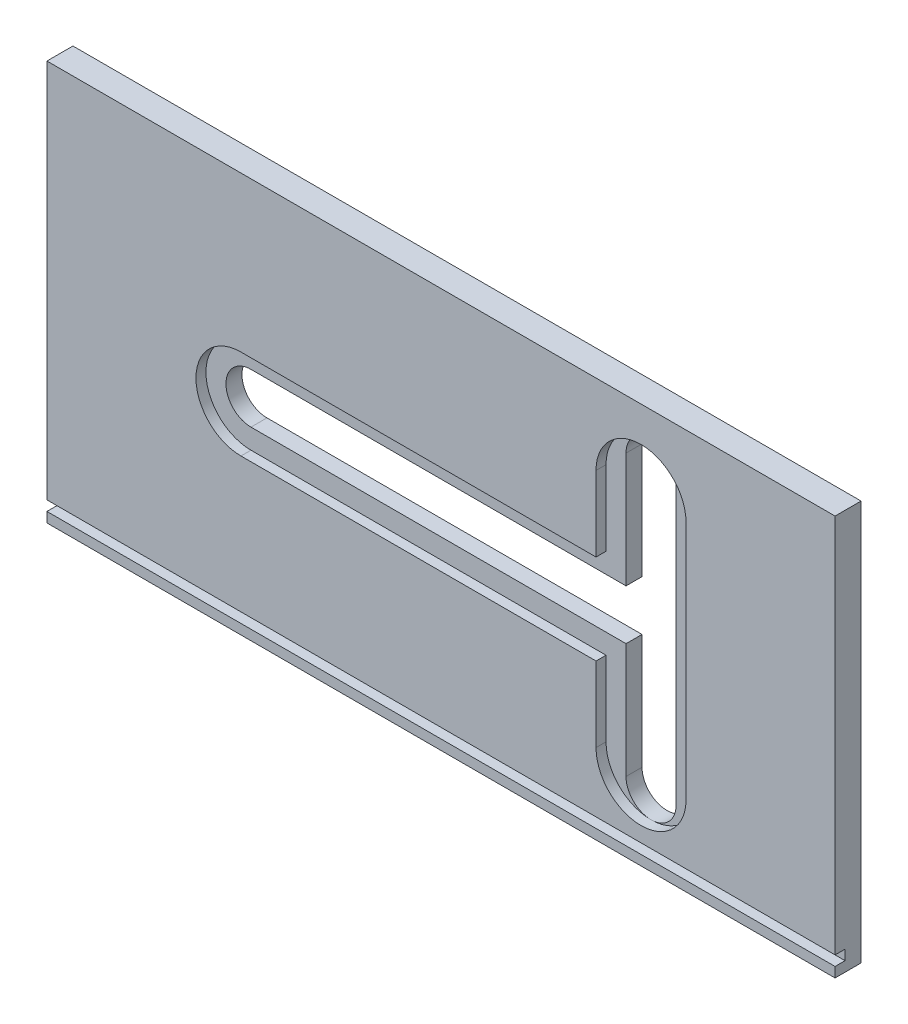
from build123d import *

# Parameters (mm, degrees)
SKETCH_1_W          = 394
SKETCH_1_H          = 200
EXTRUDE_1_DEPTH     = 13
SKETCH_2_W          = 394
SKETCH_2_H          = 5
CUT_EXTRUDE_1_DEPTH = 5
CUT_EXTRUDE_2_DEPTH = 363.900192956
CUT_EXTRUDE_3_DEPTH = 5


with BuildPart() as part:
    # ｽｹｯﾁ1 → ﾎﾞｽ - 押し出し1 (new body)
    with BuildSketch(Plane.XY):
        with Locations((127.719868277, 61.507142857)):
            Rectangle(SKETCH_1_W, SKETCH_1_H)
    extrude(amount=EXTRUDE_1_DEPTH)

    # ｽｹｯﾁ2 → ｶｯﾄ - 押し出し1 (cut)
    with BuildSketch(Plane.XY.offset(13)):
        with Locations((127.719868277, -30.992857143)):
            Rectangle(SKETCH_2_W, SKETCH_2_H)
    extrude(amount=-CUT_EXTRUDE_1_DEPTH, mode=Mode.SUBTRACT)

    # ｽｹｯﾁ3 → ｶｯﾄ - 押し出し2 (cut, through all)
    with BuildSketch(Plane.XY.offset(13)):
        with BuildLine():
            Line((27.719868277, 74.007142857), (215.219868277, 74.007142857))
            Line((215.219868277, 74.007142857), (215.219868277, 131.507142857))
            ThreePointArc((215.219868277, 131.507142857), (227.719868277, 144.007142857), (240.219868277, 131.507142857))
            Line((240.219868277, 131.507142857), (240.219868277, -8.492857143))
            ThreePointArc((240.219868277, -8.492857143), (227.719868277, -20.992857143), (215.219868277, -8.492857143))
            Line((215.219868277, -8.492857143), (215.219868277, 49.007142857))
            Line((215.219868277, 49.007142857), (27.719868277, 49.007142857))
            ThreePointArc((27.719868277, 49.007142857), (15.219868277, 61.507142857), (27.719868277, 74.007142857))
        make_face()
    extrude(amount=-CUT_EXTRUDE_2_DEPTH, mode=Mode.SUBTRACT)

    # ｽｹｯﾁ6 → ｶｯﾄ - 押し出し3 (cut)
    with BuildSketch(Plane.XY.offset(13)):
        with BuildLine():
            Line((27.719868277, 84.007142857), (205.219868277, 84.007142857))
            Line((205.219868277, 84.007142857), (205.219868277, 121.507142857))
            ThreePointArc((205.219868277, 121.507142857), (227.719868277, 144.007142857), (250.219868277, 121.507142857))
            Line((250.219868277, 121.507142857), (250.219868277, 1.507142857))
            ThreePointArc((250.219868277, 1.507142857), (227.719868277, -20.992857143), (205.219868277, 1.507142857))
            Line((205.219868277, 1.507142857), (205.219868277, 39.007142857))
            Line((205.219868277, 39.007142857), (27.719868277, 39.007142857))
            ThreePointArc((27.719868277, 39.007142857), (5.219868277, 61.507142857), (27.719868277, 84.007142857))
        make_face()
    extrude(amount=-CUT_EXTRUDE_3_DEPTH, mode=Mode.SUBTRACT)


solid = part.part
